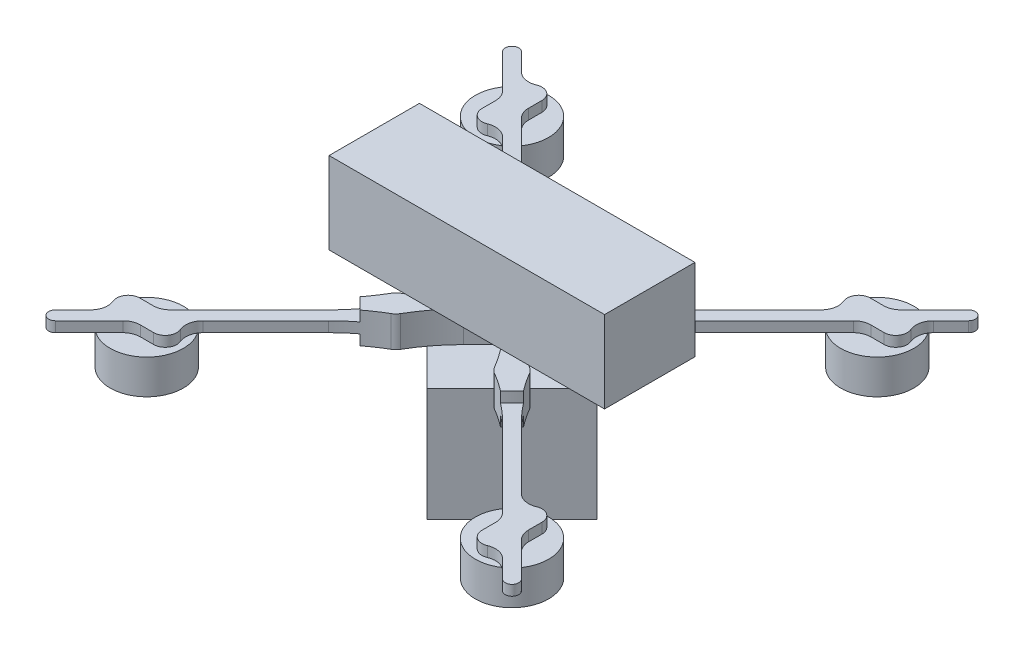
from build123d import *

# Parameters (mm, degrees)
BOSS_EXTRUDE1_DEPTH      = 2.4
SKETCH6_R                = 8.5
BOSS_EXTRUDE5_DEPTH      = 8
FILLET1_R                = 4
FILLET2_R                = 40
CIRPATTERN3_COUNT        = 4
CIRPATTERN1_COUNT        = 4
FILLET1_OF_CIRPATTERN1_R = 4
FILLET2_OF_CIRPATTERN1_R = 40
BOSS_EXTRUDE2_DEPTH      = 2.4
BOSS_EXTRUDE2_DEPTH_BACK = 4.8
BOSS_EXTRUDE3_DEPTH      = 26.4
SKETCH5_W                = 64
SKETCH5_H                = 21
BOSS_EXTRUDE4_DEPTH      = 19


with BuildPart() as part:
    # Sketch1 → Boss-Extrude1 (new body)
    with BuildSketch(Plane(origin=(0, 0, 0), x_dir=(1, 0, 0), z_dir=(0, 1, 0))):
        with BuildLine():
            Line((-14.204008209, 16.396039231), (-39.751406871, 41.943437893))
            Line((-39.751406871, 41.943437893), (-39.751406871, 46.726406871))
            ThreePointArc((-39.751406871, 46.726406871), (-42.166851335, 49.388784741), (-45.051037468, 47.24306849))
            Line((-45.051037468, 47.24306849), (-51.936993078, 54.1290241))
            ThreePointArc((-51.936993078, 54.1290241), (-54.1290241, 54.1290241), (-54.1290241, 51.936993078))
            Line((-54.1290241, 51.936993078), (-45.101406871, 42.90937585))
            Line((-45.101406871, 42.90937585), (-45.101406871, 38.126406871))
            ThreePointArc((-45.101406871, 38.126406871), (-42.685962407, 35.464029001), (-39.801776274, 37.609745252))
            Line((-39.801776274, 37.609745252), (-16.396039231, 14.204008209))
            ThreePointArc((-16.396039231, 14.204008209), (-15.605097935, 11.362457248), (-12.763546973, 10.571515952))
            Line((-12.763546973, 10.571515952), (-2.192031022, 0))
            Line((-2.192031022, 0), (0, 0))
            Line((0, 0), (0, 2.192031022))
            Line((0, 2.192031022), (-10.571515952, 12.763546973))
            ThreePointArc((-10.571515952, 12.763546973), (-11.362457248, 15.605097935), (-14.204008209, 16.396039231))
        make_face()
    boss_extrude1 = extrude(amount=BOSS_EXTRUDE1_DEPTH)

    # Fillet1
    fillet1_edges = [part.edges().sort_by_distance(p)[0] for p in [
        (-39.751406871, 1.2, -41.943437893),
        (-45.051037468, 1.2, -47.24306849),
        (-45.101406871, 1.2, -42.90937585),
        (-39.801776274, 1.2, -37.609745252),
    ]]
    fillet(fillet1_edges, radius=FILLET1_R)

    # Fillet2
    fillet2_edges = [part.edges().sort_by_distance(p)[0] for p in [
        (-10.571515952, 1.2, -12.763546973),
        (-14.204008209, 1.2, -16.396039231),
        (-16.396039231, 1.2, -14.204008209),
        (-12.763546973, 1.2, -10.571515952),
    ]]
    fillet(fillet2_edges, radius=FILLET2_R)

    # CirPattern1: Boss-Extrude1 ×4 about axis
    cirpattern1_axis = Axis((0, 2.4, 0), (0, -1, 0))
    for i in range(1, CIRPATTERN1_COUNT):
        add(boss_extrude1.rotate(cirpattern1_axis, i * 360 / CIRPATTERN1_COUNT))

    # Fillet1 of CirPattern1
    fillet1_of_cirpattern1_edges = [part.edges().sort_by_distance(p)[0] for p in [
        (41.943437893, 1.2, -39.751406871),
        (47.24306849, 1.2, -45.051037468),
        (42.90937585, 1.2, -45.101406871),
        (37.609745252, 1.2, -39.801776274),
        (39.751406871, 1.2, 41.943437893),
        (45.051037468, 1.2, 47.24306849),
        (45.101406871, 1.2, 42.90937585),
        (39.801776274, 1.2, 37.609745252),
        (-41.943437893, 1.2, 39.751406871),
        (-47.24306849, 1.2, 45.051037468),
        (-42.90937585, 1.2, 45.101406871),
        (-37.609745252, 1.2, 39.801776274),
    ]]
    fillet(fillet1_of_cirpattern1_edges, radius=FILLET1_OF_CIRPATTERN1_R)

    # Fillet2 of CirPattern1
    fillet2_of_cirpattern1_edges = [part.edges().sort_by_distance(p)[0] for p in [
        (12.763546973, 1.2, -10.571515952),
        (16.396039231, 1.2, -14.204008209),
        (14.204008209, 1.2, -16.396039231),
        (10.571515952, 1.2, -12.763546973),
        (10.571515952, 1.2, 12.763546973),
        (14.204008209, 1.2, 16.396039231),
        (16.396039231, 1.2, 14.204008209),
        (12.763546973, 1.2, 10.571515952),
        (-12.763546973, 1.2, 10.571515952),
        (-16.396039231, 1.2, 14.204008209),
        (-14.204008209, 1.2, 16.396039231),
        (-10.571515952, 1.2, 12.763546973),
    ]]
    fillet(fillet2_of_cirpattern1_edges, radius=FILLET2_OF_CIRPATTERN1_R)

    # Sketch3 → Boss-Extrude2 (add, two sides: drawn at the far end of the back side and taken through both)
    with BuildSketch(Plane(origin=(0, 2.4, 0), x_dir=(1, 0, 0), z_dir=(0, 1, 0)).offset(-BOSS_EXTRUDE2_DEPTH_BACK)):
        with BuildLine():
            Line((-6.750441277, 4.558410255), (-2.192031022, 0))
            Line((-2.192031022, 0), (-6.750441277, -4.558410255))
            ThreePointArc((-6.750441277, -4.558410255), (-10.662549805, -7.991605558), (-14.987331191, -10.887756295))
            ThreePointArc((-14.987331191, -10.887756295), (-15.605097935, -11.362457248), (-16.079798888, -11.980223991))
            ThreePointArc((-16.079798888, -11.980223991), (-17.452690035, -14.182654471), (-18.965514878, -16.291419778))
            ThreePointArc((-18.965514878, -16.291419778), (-17.679099425, -17.679099425), (-16.291419778, -18.965514878))
            ThreePointArc((-16.291419778, -18.965514878), (-14.182654471, -17.452690035), (-11.980223991, -16.079798888))
            ThreePointArc((-11.980223991, -16.079798888), (-11.362457248, -15.605097935), (-10.887756295, -14.987331191))
            ThreePointArc((-10.887756295, -14.987331191), (-7.991605558, -10.662549805), (-4.558410255, -6.750441277))
            Line((-4.558410255, -6.750441277), (0, -2.192031022))
            Line((0, -2.192031022), (4.558410255, -6.750441277))
            ThreePointArc((4.558410255, -6.750441277), (7.991605558, -10.662549805), (10.887756295, -14.987331191))
            ThreePointArc((10.887756295, -14.987331191), (11.362457248, -15.605097935), (11.980223991, -16.079798888))
            ThreePointArc((11.980223991, -16.079798888), (14.182654471, -17.452690035), (16.291419778, -18.965514878))
            ThreePointArc((16.291419778, -18.965514878), (17.679099425, -17.679099425), (18.965514878, -16.291419778))
            ThreePointArc((18.965514878, -16.291419778), (17.452690035, -14.182654471), (16.079798888, -11.980223991))
            ThreePointArc((16.079798888, -11.980223991), (15.605097935, -11.362457248), (14.987331191, -10.887756295))
            ThreePointArc((14.987331191, -10.887756295), (10.662549805, -7.991605558), (6.750441277, -4.558410255))
            Line((6.750441277, -4.558410255), (2.192031022, 0))
            Line((2.192031022, 0), (6.750441277, 4.558410255))
            ThreePointArc((6.750441277, 4.558410255), (10.662549805, 7.991605558), (14.987331191, 10.887756295))
            ThreePointArc((14.987331191, 10.887756295), (15.605097935, 11.362457248), (16.079798888, 11.980223991))
            ThreePointArc((16.079798888, 11.980223991), (17.452690035, 14.182654471), (18.965514878, 16.291419778))
            ThreePointArc((18.965514878, 16.291419778), (17.679099425, 17.679099425), (16.291419778, 18.965514878))
            ThreePointArc((16.291419778, 18.965514878), (14.182654471, 17.452690035), (11.980223991, 16.079798888))
            ThreePointArc((11.980223991, 16.079798888), (11.362457248, 15.605097935), (10.887756295, 14.987331191))
            ThreePointArc((10.887756295, 14.987331191), (7.991605558, 10.662549805), (4.558410255, 6.750441277))
            Line((4.558410255, 6.750441277), (0, 2.192031022))
            Line((0, 2.192031022), (-4.558410255, 6.750441277))
            ThreePointArc((-4.558410255, 6.750441277), (-7.991605558, 10.662549805), (-10.887756295, 14.987331191))
            ThreePointArc((-10.887756295, 14.987331191), (-11.362457248, 15.605097935), (-11.980223991, 16.079798888))
            ThreePointArc((-11.980223991, 16.079798888), (-14.182654471, 17.452690035), (-16.291419778, 18.965514878))
            ThreePointArc((-16.291419778, 18.965514878), (-17.679099425, 17.679099425), (-18.965514878, 16.291419778))
            ThreePointArc((-18.965514878, 16.291419778), (-17.452690035, 14.182654471), (-16.079798888, 11.980223991))
            ThreePointArc((-16.079798888, 11.980223991), (-15.605097935, 11.362457248), (-14.987331191, 10.887756295))
            ThreePointArc((-14.987331191, 10.887756295), (-10.662549805, 7.991605558), (-6.750441277, 4.558410255))
        make_face()
    extrude(amount=BOSS_EXTRUDE2_DEPTH + BOSS_EXTRUDE2_DEPTH_BACK)


with BuildPart() as body_2:
    # Sketch6 → Boss-Extrude5 (new body)
    with BuildSketch(Plane.XZ):
        with Locations((-42.426406871, -42.426406871)):
            Circle(SKETCH6_R)
    extrude(amount=BOSS_EXTRUDE5_DEPTH)


with BuildPart() as cirpattern3_1:
    # CirPattern3: pattern copy
    add(body_2.part.rotate(Axis((0, 2.4, 0), (0, -1, 0)), 1 * 360 / CIRPATTERN3_COUNT))


with BuildPart() as cirpattern3_2:
    # CirPattern3: pattern copy
    add(body_2.part.rotate(Axis((0, 2.4, 0), (0, -1, 0)), 2 * 360 / CIRPATTERN3_COUNT))


with BuildPart() as cirpattern3_3:
    # CirPattern3: pattern copy
    add(body_2.part.rotate(Axis((0, 2.4, 0), (0, -1, 0)), 3 * 360 / CIRPATTERN3_COUNT))


with BuildPart() as body_6:
    # Sketch4 → Boss-Extrude3 (new body)
    with BuildSketch(Plane.XZ.offset(2.4)):
        Polygon((-19.798989873, 0), (0, -19.798989873), (19.798989873, 0), (0, 19.798989873), align=None)
    extrude(amount=BOSS_EXTRUDE3_DEPTH)


with BuildPart() as body_7:
    # Sketch5 → Boss-Extrude4 (new body)
    with BuildSketch(Plane(origin=(0, 4.8, 0), x_dir=(1, 0, 0), z_dir=(0, 1, 0))):
        Rectangle(SKETCH5_W, SKETCH5_H)
    extrude(amount=BOSS_EXTRUDE4_DEPTH)


solid = Compound([part.part, body_2.part, cirpattern3_1.part, cirpattern3_2.part, cirpattern3_3.part, body_6.part, body_7.part])
